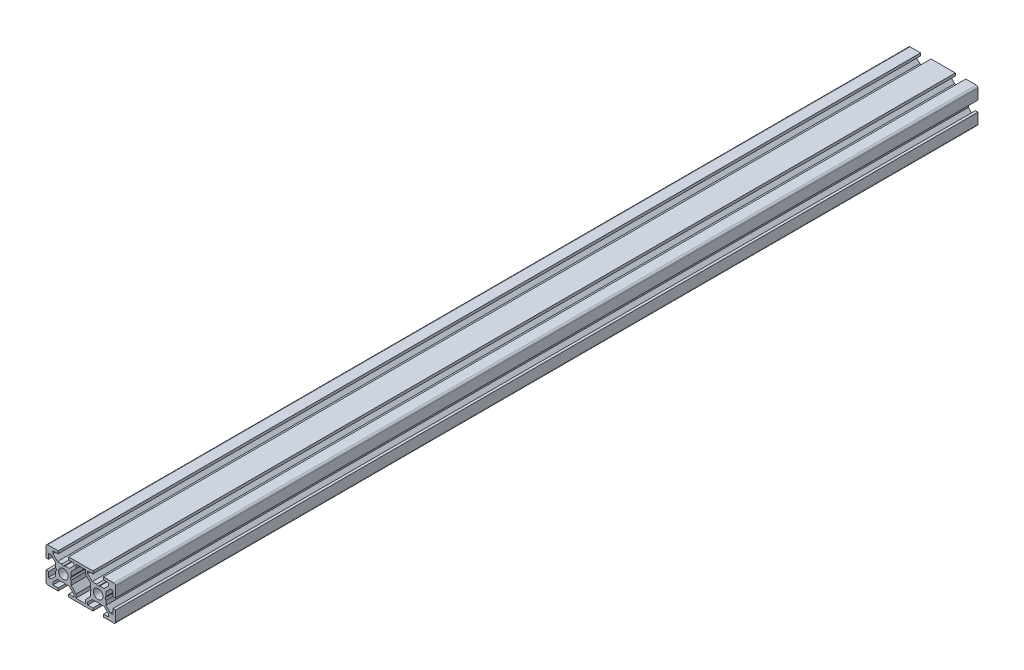
from build123d import *

# Parameters (mm, degrees)
SKETCH1_R           = 2.75
BOSS_EXTRUDE1_DEPTH = 496
FILLET2_R           = 1
FILLET4_R           = 1
FILLET5_R           = 1
FILLET6_R           = 1


with BuildPart() as part:
    # Sketch1 → Boss-Extrude1 (new body)
    with BuildSketch(Plane.XY):
        Polygon((-3.001792446, 10), (-10, 10), (-10, 3.001792446), (-8.500771543, 3.001792446), (-8.500771543, 6.014407427), (-7.045753692, 6.014407427), (-4.458187435, 3.426841169), (-4.458187435, 0.939646666), (-3.934715846, 0), (-4.45749106, -0.939646666), (-4.458187435, -3.426841169), (-7.045753692, -6.014407427), (-8.500771543, -6.014407427), (-8.500771543, -3.001792446), (-10, -3.001792446), (-10, -10), (-3.001792446, -10), (-3.001792446, -8.499999951), (-6.014791508, -8.499999951), (-6.014791508, -7.045753643), (-3.427225251, -4.458187385), (-0.939604714, -4.458187385), (-0.00108721, -3.933944043), (0.937618184, -4.457850876), (3.425238721, -4.457850876), (6.012804978, -7.045417133), (6.012804978, -8.500000007), (3.001792545, -8.500000007), (3.001792545, -10), (16.998207455, -10), (16.998207455, -8.500000007), (13.987195022, -8.500000007), (13.987195022, -7.045417133), (16.574761279, -4.457850876), (19.062381816, -4.457850876), (20.00108721, -3.933944043), (20.939604714, -4.458187385), (23.427225251, -4.458187385), (26.014791508, -7.045753643), (26.014791508, -8.499999951), (23.001792446, -8.499999951), (23.001792446, -10), (30, -10), (30, -3.001792446), (28.500771543, -3.001792446), (28.500771543, -6.014407427), (27.045753692, -6.014407427), (24.458187435, -3.426841169), (24.45749106, -0.939646666), (23.934715846, 0), (24.458187435, 0.939646666), (24.458187435, 3.426841169), (27.045753692, 6.014407427), (28.500771543, 6.014407427), (28.500771543, 3.001792446), (30, 3.001792446), (30, 10), (23.001792446, 10), (23.001792446, 8.499999951), (26.014791508, 8.499999951), (26.014791508, 7.045753643), (23.427225251, 4.458187385), (20.939604714, 4.458187385), (20.00108721, 3.933944043), (19.062381816, 4.457850876), (16.574761279, 4.457850876), (13.987195022, 7.045417133), (13.987195022, 8.499999951), (16.998207356, 8.499999951), (16.998207356, 10), (3.001792643, 10), (3.001792643, 8.499999951), (6.012804978, 8.499999951), (6.012804978, 7.045417133), (3.425238721, 4.457850876), (0.937618184, 4.457850876), (-0.00108721, 3.933944043), (-0.939604714, 4.458187385), (-3.427225251, 4.458187385), (-6.014791508, 7.045753643), (-6.014791508, 8.499999951), (-3.001792446, 8.499999951), align=None)
        Circle(SKETCH1_R, mode=Mode.SUBTRACT)
        with Locations((20, 0)):
            Circle(SKETCH1_R, mode=Mode.SUBTRACT)
        Polygon((7.208733292, -6.419793455), (7.208733292, -8.500000007), (12.791266708, -8.500000007), (12.791266708, -6.419793455), (15.541654987, -3.426231961), (15.541209058, -0.938611464), (16.065284154, 0), (15.54250894, 0.939646666), (15.541655044, 3.426231961), (12.791266708, 6.17760654), (12.791266708, 8.499999951), (7.208733292, 8.499999951), (7.208733292, 6.17760654), (4.458344956, 3.426231961), (4.45749106, 0.939646666), (3.934715846, 0), (4.458790942, -0.938611464), (4.458345013, -3.426231961), align=None, mode=Mode.SUBTRACT)
    extrude(amount=BOSS_EXTRUDE1_DEPTH)

    # Fillet2
    fillet2_edges = [part.edges().sort_by_distance(p)[0] for p in [
        (-10, -10, 248),
    ]]
    fillet(fillet2_edges, radius=FILLET2_R)

    # Fillet4
    fillet4_edges = [part.edges().sort_by_distance(p)[0] for p in [
        (-10, 10, 248),
    ]]
    fillet(fillet4_edges, radius=FILLET4_R)

    # Fillet5
    fillet5_edges = [part.edges().sort_by_distance(p)[0] for p in [
        (30, 10, 248),
    ]]
    fillet(fillet5_edges, radius=FILLET5_R)

    # Fillet6
    fillet6_edges = [part.edges().sort_by_distance(p)[0] for p in [
        (30, -10, 248),
    ]]
    fillet(fillet6_edges, radius=FILLET6_R)


solid = part.part
